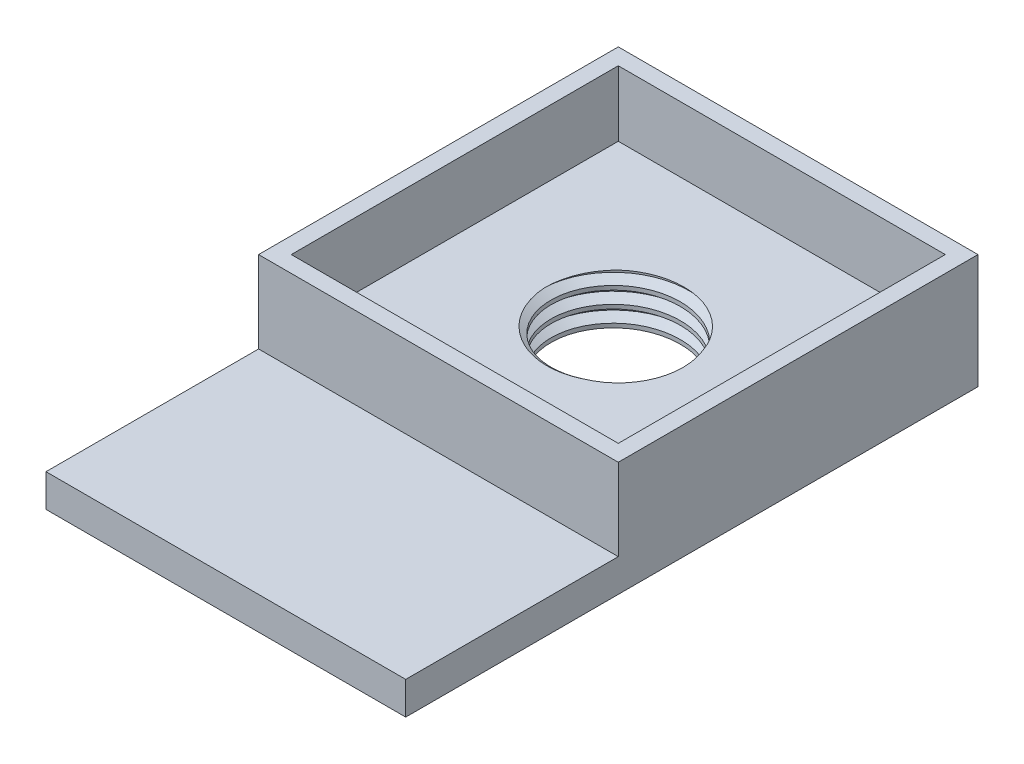
from build123d import *

# Parameters (mm, degrees)
BOSS_EXTRUDE1_DEPTH      = 5
BOSS_EXTRUDE1_DEPTH_BACK = 2
SKETCH1_W                = 22
SKETCH1_H                = 22
SKETCH1_W_2              = 20
SKETCH1_H_2              = 20
BOSS_EXTRUDE2_DEPTH      = 1
BOSS_EXTRUDE2_DEPTH_BACK = 2
SKETCH1_2_W              = 20
SKETCH1_2_H              = 20
SKETCH2_3_R              = 4.5
CUT_EXTRUDE1_DEPTH       = 7
BOSS_EXTRUDE3_DEPTH      = 2
THREAD2_PITCH            = 1
THREAD2_FROM             = 1
THREAD2_TO               = 4


with BuildPart() as part:
    # Sketch1 → Boss-Extrude1 (new, two sides: drawn at the far end of the back side and taken through both)
    with BuildSketch(Plane(origin=(0, 0, 0), x_dir=(1, 0, 0), z_dir=(0, 1, 0)).offset(-BOSS_EXTRUDE1_DEPTH_BACK)):
        Rectangle(SKETCH1_W, SKETCH1_H)
        Rectangle(SKETCH1_W_2, SKETCH1_H_2, mode=Mode.SUBTRACT)
    extrude(amount=BOSS_EXTRUDE1_DEPTH + BOSS_EXTRUDE1_DEPTH_BACK)

    # Sketch1<2> → Boss-Extrude2 (add, two sides: drawn at the far end of the back side and taken through both)
    with BuildSketch(Plane(origin=(0, 0, 0), x_dir=(1, 0, 0), z_dir=(0, 1, 0)).offset(-BOSS_EXTRUDE2_DEPTH_BACK)):
        Rectangle(SKETCH1_2_W, SKETCH1_2_H)
    extrude(amount=BOSS_EXTRUDE2_DEPTH + BOSS_EXTRUDE2_DEPTH_BACK)

    # Sketch2<3> → Cut-Extrude1 (cut)
    with BuildSketch(Plane.XZ.offset(2)):
        with Locations(Location((0, 0, 0), (0, 0, 270))):
            Circle(SKETCH2_3_R)
    extrude(amount=-CUT_EXTRUDE1_DEPTH, mode=Mode.SUBTRACT)

    # Sketch3 → Boss-Extrude3 (add)
    with BuildSketch(Plane(origin=(0, 0, 0), x_dir=(1, 0, 0), z_dir=(0, 1, 0))):
        Polygon((11, -11), (0, -11), (0, -20), (8, -20), (8, -24), (10.75, -24), (11, -24), align=None)
        Polygon((0, -20), (0, -11), (-11, -11), (-11, -24), (-10.75, -24), (-9.902677218, -24), (-8, -24), (-8, -20), align=None)
        Polygon((0, -24), (0, -20), (-8, -20), (-1, -21.75), (-1, -24), align=None)
        Polygon((-1, -21.75), (-8, -20), (-3, -24), (-2.000639594, -24), (-1, -24), align=None)
        Polygon((-3, -24), (-8, -20), (-8, -24), align=None)
        Polygon((8, -20), (0, -20), (0, -24), (1, -24), (1, -21.75), align=None)
        Polygon((3, -24), (8, -20), (1, -21.75), (1, -24), align=None)
        Polygon((8, -24), (8, -20), (3, -24), align=None)
    extrude(amount=-BOSS_EXTRUDE3_DEPTH)

    # Thread2: arcs per turn and ends read off the stored shape
    # Thread2: the profile of Thread Profile3 profile screwed along a right-hand helix through 10 turns, 8 arcs to a turn; built about Z, then put on its axis
    thread2_z = Axis((0, 0, 0), (0, 0, 1))
    thread2_corners = [(4.5003, 0, -0.000173205), (4.5003, 0, 0.875173202), (3.958734125, 0, 0.562499999), (3.958734125, 0, 0.312499999)]
    with BuildLine(mode=Mode.PRIVATE) as thread2_profile:
        Line(thread2_corners[0], thread2_corners[1])
        Line(thread2_corners[1], thread2_corners[2])
        Line(thread2_corners[2], thread2_corners[3])
        Line(thread2_corners[3], thread2_corners[0])
    thread2_cap = Face(thread2_profile.wire())
    thread2_turn_angles = [0, 22.5, 45, 67.5, 90, 112.5, 135, 157.5, 180, 202.5, 225, 247.5, 270, 292.5, 315, 337.5, 360]
    thread2_turn_weights = [1, 0.9238795325112867, 1, 0.9238795325112867, 1, 0.9238795325112867, 1, 0.9238795325112867, 1, 0.9238795325112867, 1, 0.9238795325112867, 1, 0.9238795325112867, 1, 0.9238795325112867, 1]
    thread2_turn_rails = [Edge.make_bspline([Vector(p[0], p[1], 0).rotate(thread2_z, thread2_turn_angles[k]) / thread2_turn_weights[k] + Vector(0, 0, p[2] + THREAD2_PITCH * thread2_turn_angles[k] / 360) for k in range(17)], [0, 0, 0, 1, 1, 2, 2, 3, 3, 4, 4, 5, 5, 6, 6, 7, 7, 8, 8, 8], 2, thread2_turn_weights) for p in thread2_corners]
    thread2_turn_sides = [Face.make_surface_from_curves(thread2_turn_rails[p[0]], thread2_turn_rails[p[1]]) for p in [(0, 1), (1, 2), (2, 3), (3, 0)]]
    thread2 = Plane(origin=(0, 2, 0), x_dir=(-1, 0, 0), z_dir=(0, -1, 0)) * split(split(Solid(Shell([*[p.moved(Location((0, 0, THREAD2_PITCH * i))) for i in range(10) for p in thread2_turn_sides], thread2_cap, thread2_cap.rotate(thread2_z, 3600).moved(Location((0, 0, THREAD2_PITCH * 3600 / 360)))])), bisect_by=Plane.XY.offset(THREAD2_FROM), keep=Keep.TOP, mode=Mode.PRIVATE), bisect_by=Plane.XY.offset(THREAD2_TO), keep=Keep.BOTTOM, mode=Mode.PRIVATE)
    add(thread2)


solid = part.part
